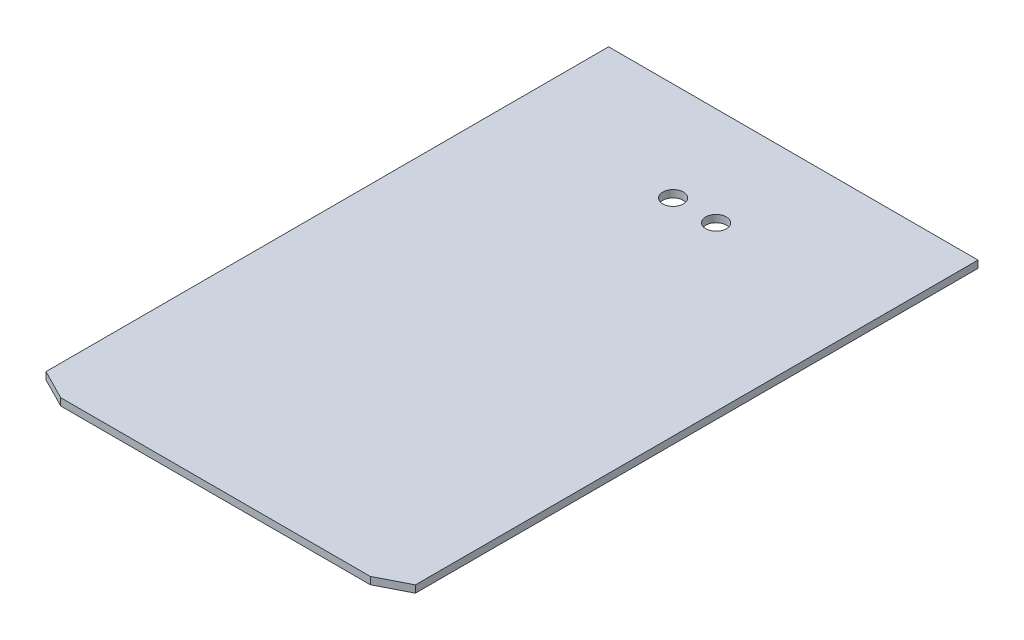
from build123d import *

# Parameters (mm, degrees)
SKETCH1_R           = 1
BOSS_EXTRUDE1_DEPTH = 0.7
SKETCH2_R           = 1
CUT_EXTRUDE1_DEPTH  = 4.5
SKETCH4_OUTSIDE_W   = 59.056
SKETCH4_OUTSIDE_H   = 73.256
CUT_EXTRUDE2_DEPTH  = 10


with BuildPart() as part:
    # Sketch1 → Boss-Extrude1 (new body)
    with BuildSketch(Plane(origin=(0, 0, 0), x_dir=(1, 0, 0), z_dir=(0, 1, 0))):
        Polygon((-21.4, 26.5), (-20.9, 26.5), (-20.9, -23.5), (-15, -26.5), (15, -26.5), (20.9, -23.5), (20.9, 26.5), (21.4, 26.5), (21.4, 29.5), (20.4, 30.5), (-20.4, 30.5), (-21.4, 29.5), align=None)
        with Locations((-19.944365081, 29.181392426)):
            Circle(SKETCH1_R, mode=Mode.SUBTRACT)
        with Locations((19.944365081, 29.181392426)):
            Circle(SKETCH1_R, mode=Mode.SUBTRACT)
    extrude(amount=BOSS_EXTRUDE1_DEPTH)

    # Sketch2 → Cut-Extrude1 (cut)
    with BuildSketch(Plane(origin=(0, 0.7, 0), x_dir=(1, 0, 0), z_dir=(0, 1, 0))):
        with Locations((-2.084530189, 19.934465076)):
            Circle(SKETCH2_R)
        with Locations((2.084530189, 19.934465076)):
            Circle(SKETCH2_R)
    extrude(amount=-CUT_EXTRUDE1_DEPTH, mode=Mode.SUBTRACT)

    # Sketch4 outside → Cut-Extrude2 (cut)
    with BuildSketch(Plane(origin=(0, 0.7, 0), x_dir=(1, 0, 0), z_dir=(0, 1, 0))):
        with Locations((0, 2)):
            Rectangle(SKETCH4_OUTSIDE_W, SKETCH4_OUTSIDE_H)
        Polygon((-17.9, 29.5), (-17.9, -26.5), (17.9, -26.5), (17.9, 29.5), (0, 29.5), align=None, mode=Mode.SUBTRACT)
    extrude(amount=-CUT_EXTRUDE2_DEPTH, mode=Mode.SUBTRACT)


solid = part.part
